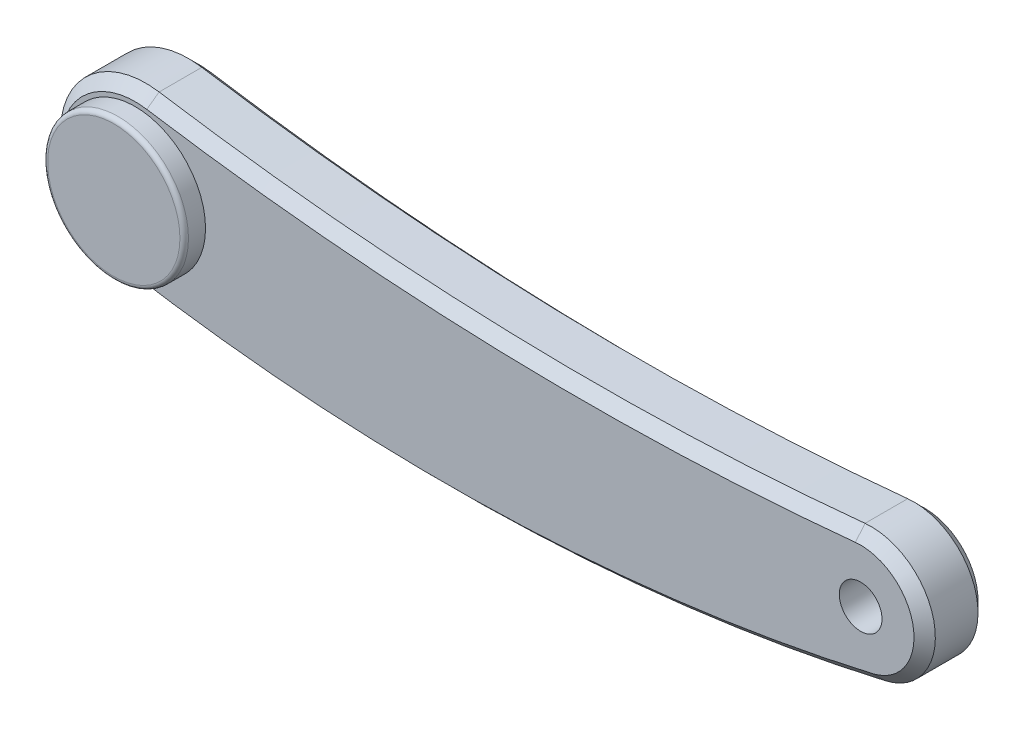
from build123d import *

# Parameters (mm, degrees)
BOSS_EXTRUDE1_DEPTH = 7.5
CHAMFER1_SIZE       = 2.5
SKETCH2_R           = 16.5
BOSS_EXTRUDE2_DEPTH = 5
BOSS_EXTRUDE3_START = -5
SKETCH3_R           = 16.5
SKETCH3_R_2         = 2
BOSS_EXTRUDE3_DEPTH = 5
FILLET1_R           = 1
SKETCH4_R           = 5
CUT_EXTRUDE1_DEPTH  = 10
SKETCH5_R           = 5
BOSS_EXTRUDE4_DEPTH = 10


with BuildPart() as part:
    # Sketch1 → Boss-Extrude1 (new, symmetric)
    with BuildSketch(Plane.XY):
        with BuildLine():
            ThreePointArc((83.525541796, 14.927356531), (0.670209279, 12.056118586), (-81.876646181, 19.754611131))
            ThreePointArc((-81.876646181, 19.754611131), (-104.735379495, 3.242652649), (-88.361833105, -19.715427415))
            ThreePointArc((-88.361833105, -19.715427415), (0.256800738, -25.931146508), (88.369675456, -14.61660998))
            ThreePointArc((88.369675456, -14.61660998), (99.802346146, 2.427045238), (83.525541796, 14.927356531))
        make_face()
    extrude(amount=BOSS_EXTRUDE1_DEPTH, both=True)

    # Chamfer1
    chamfer1_edges = [part.edges().sort_by_distance(p)[0] for p in [
        (99.802346146, 2.427045238, -7.5),
        (0.670209279, 12.056118586, -7.5),
        (-104.735379495, 3.242652649, -7.5),
        (0.256800738, -25.931146508, -7.5),
        (-104.735379495, 3.242652649, 7.5),
        (0.670209279, 12.056118586, 7.5),
        (99.802346146, 2.427045238, 7.5),
        (0.256800738, -25.931146508, 7.5),
    ]]
    chamfer(chamfer1_edges, length=CHAMFER1_SIZE)

    # Sketch2 → Boss-Extrude2 (add)
    with BuildSketch(Plane.XY.offset(7.5)):
        with Locations((-85, 0)):
            Circle(SKETCH2_R)
    extrude(amount=BOSS_EXTRUDE2_DEPTH)

    # Sketch3 → Boss-Extrude3 (add)
    # profile 1 of 2: a face of its own
    with BuildSketch(Plane.XY.offset(12.5).offset(BOSS_EXTRUDE3_START)):
        with Locations((-85, 0)):
            Circle(SKETCH3_R)
        with BuildLine():
            ThreePointArc((-87.063800013, -0.552993547), (-87.488343777, -0.236721672), (-87.961871133, 0))
            Line((-87.961871133, 0), (-88.909676119, 0))
            ThreePointArc((-88.909676119, 0), (-88.554865966, 0.021055597), (-88.205036307, 0.083926829))
            ThreePointArc((-88.205036307, 0.083926829), (-88.551096111, 0.165020569), (-88.904318043, 0.204616638))
            Line((-88.904318043, 0.204616638), (-87.957811991, 0.155012358))
            ThreePointArc((-87.957811991, 0.155012358), (-87.416740514, 0.397857944), (-86.934015005, 0.742398803))
            ThreePointArc((-86.934015005, 0.742398803), (-87.062207135, 1.321448974), (-87.301806189, 1.863965899))
            Line((-87.301806189, 1.863965899), (-88.038389006, 2.460438904))
            ThreePointArc((-88.038389006, 2.460438904), (-87.749399013, 2.253512912), (-87.437964157, 2.082218099))
            ThreePointArc((-87.437964157, 2.082218099), (-87.655869193, 2.363022262), (-87.905455577, 2.616083952))
            Line((-87.905455577, 2.616083952), (-87.201099206, 1.981878627))
            ThreePointArc((-87.201099206, 1.981878627), (-86.690802086, 1.840945466), (-86.163677393, 1.791906047))
            ThreePointArc((-86.163677393, 1.791906047), (-85.994076204, 2.293404544), (-85.915268515, 2.816906841))
            Line((-85.915268515, 2.816906841), (-86.208156363, 3.718322949))
            ThreePointArc((-86.208156363, 3.718322949), (-86.078488934, 3.387384979), (-85.910591529, 3.074105482))
            ThreePointArc((-85.910591529, 3.074105482), (-85.94040516, 3.428287256), (-86.01189864, 3.776457135))
            Line((-86.01189864, 3.776457135), (-85.766588658, 2.860947821))
            ThreePointArc((-85.766588658, 2.860947821), (-85.3684285, 2.42140168), (-84.891580284, 2.06877142))
            ThreePointArc((-84.891580284, 2.06877142), (-84.380484393, 2.369625723), (-83.938560315, 2.765144915))
            Line((-83.938560315, 2.765144915), (-83.598897386, 3.649997098))
            ThreePointArc((-83.598897386, 3.649997098), (-83.706392879, 3.311207634), (-83.773065265, 2.962082477))
            ThreePointArc((-83.773065265, 2.962082477), (-83.573340995, 3.256095739), (-83.40979146, 3.571666859))
            Line((-83.40979146, 3.571666859), (-83.795298478, 2.705803919))
            ThreePointArc((-83.795298478, 2.705803919), (-83.771643397, 2.176931776), (-83.655392168, 1.660452388))
            ThreePointArc((-83.655392168, 1.660452388), (-83.126029104, 1.654123631), (-82.603795919, 1.740944171))
            Line((-82.603795919, 1.740944171), (-81.837005578, 2.298049964))
            ThreePointArc((-81.837005578, 2.298049964), (-82.111676851, 2.072463453), (-82.357740207, 1.815974843))
            ThreePointArc((-82.357740207, 1.815974843), (-82.030106241, 1.953777479), (-81.721069709, 2.129362228))
            Line((-81.721069709, 2.129362228), (-82.515965855, 1.613150636))
            ThreePointArc((-82.515965855, 1.613150636), (-82.810960821, 1.098650595), (-82.998977926, 0.536172249))
            ThreePointArc((-82.998977926, 0.536172249), (-82.554911164, 0.143060264), (-82.042188009, -0.155012358))
            Line((-82.042188009, -0.155012358), (-81.095681957, -0.204616638))
            ThreePointArc((-81.095681957, -0.204616638), (-81.451107819, -0.207074051), (-81.803748474, -0.251550451))
            ThreePointArc((-81.803748474, -0.251550451), (-81.462407052, -0.350644424), (-81.111741496, -0.408672437))
            Line((-81.111741496, -0.408672437), (-82.054354307, -0.309599838))
            ThreePointArc((-82.054354307, -0.309599838), (-82.550031783, -0.495527637), (-83.005309265, -0.765690034))
            ThreePointArc((-83.005309265, -0.765690034), (-82.847746089, -1.271099919), (-82.603795919, -1.740944171))
            Line((-82.603795919, -1.740944171), (-81.837005578, -2.298049964))
            ThreePointArc((-81.837005578, -2.298049964), (-82.13642919, -2.106532125), (-82.456402112, -1.951771306))
            ThreePointArc((-82.456402112, -1.951771306), (-82.224099554, -2.220786368), (-81.961610994, -2.460438904))
            Line((-81.961610994, -2.460438904), (-82.698193811, -1.863965899))
            ThreePointArc((-82.698193811, -1.863965899), (-83.278670885, -1.742398271), (-83.871720062, -1.737398746))
            ThreePointArc((-83.871720062, -1.737398746), (-84.1083676, -2.281209618), (-84.233411342, -2.860947821))
            Line((-84.233411342, -2.860947821), (-83.98810136, -3.776457135))
            ThreePointArc((-83.98810136, -3.776457135), (-84.10027113, -3.439186435), (-84.251542655, -3.117549205))
            ThreePointArc((-84.251542655, -3.117549205), (-84.240306325, -3.472805911), (-84.187132628, -3.824240315))
            Line((-84.187132628, -3.824240315), (-84.384192365, -2.897147142))
            ThreePointArc((-84.384192365, -2.897147142), (-84.714192974, -2.483184699), (-85.111821161, -2.133674854))
            ThreePointArc((-85.111821161, -2.133674854), (-85.543804826, -2.439706584), (-85.915268515, -2.816906841))
            Line((-85.915268515, -2.816906841), (-86.208156363, -3.718322949))
            ThreePointArc((-86.208156363, -3.718322949), (-86.118539059, -3.374371905), (-86.070229845, -3.022235848))
            ThreePointArc((-86.070229845, -3.022235848), (-86.254292934, -3.326298936), (-86.401102614, -3.649997098))
            Line((-86.401102614, -3.649997098), (-86.061439685, -2.765144915))
            ThreePointArc((-86.061439685, -2.765144915), (-86.12519928, -2.175511948), (-86.303706723, -1.609943726))
            ThreePointArc((-86.303706723, -1.609943726), (-86.894029708, -1.552925343), (-87.484034145, -1.613150636))
            Line((-87.484034145, -1.613150636), (-88.278930291, -2.129362228))
            ThreePointArc((-88.278930291, -2.129362228), (-87.992829159, -1.91846006), (-87.733679448, -1.67520092))
            ThreePointArc((-87.733679448, -1.67520092), (-88.068076435, -1.795667665), (-88.385878839, -1.954838059))
            Line((-88.385878839, -1.954838059), (-87.565055644, -1.480935566))
            ThreePointArc((-87.565055644, -1.480935566), (-87.27332976, -1.039164907), (-87.063800013, -0.552993547))
        make_face(mode=Mode.SUBTRACT)
    # profile 2 of 2: a face of its own
    with BuildSketch(Plane.XY.offset(12.5).offset(BOSS_EXTRUDE3_START)):
        with Locations((-85, 0)):
            Circle(SKETCH3_R_2)
    extrude(amount=BOSS_EXTRUDE3_DEPTH)

    # Fillet1
    fillet1_edges = [part.edges().sort_by_distance(p)[0] for p in [
        (-101.5, 0, 12.5),
    ]]
    fillet(fillet1_edges, radius=FILLET1_R)

    # Sketch4 → Cut-Extrude1 (cut)
    with BuildSketch(Plane.XY.offset(7.5)):
        with Locations((85, 0)):
            Circle(SKETCH4_R)
    extrude(amount=-CUT_EXTRUDE1_DEPTH, mode=Mode.SUBTRACT)

    # Sketch5 → Boss-Extrude4 (add)
    with BuildSketch(Plane(origin=(0, 0, -7.5), x_dir=(-1, 0, 0), z_dir=(0, 0, -1))):
        with Locations((85, 0)):
            Circle(SKETCH5_R)
    extrude(amount=BOSS_EXTRUDE4_DEPTH)


solid = part.part
